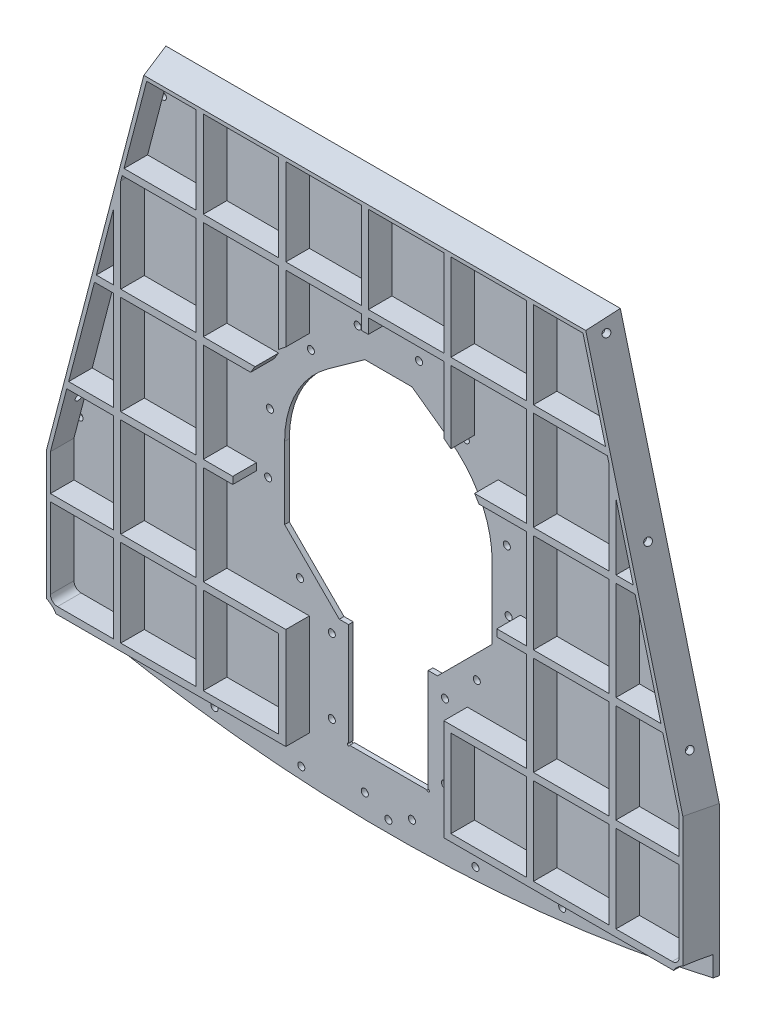
from build123d import *
from OCP.BRepFilletAPI import BRepFilletAPI_MakeChamfer

# Parameters (mm, degrees)
EXTRUDE_1_DEPTH          = 60
CHAMFER_1_SIZE           = 60
CHAMFER_1_SIZE_2         = 20
CUT_EXTRUDE_1_DEPTH      = 267.176633084
CUT_EXTRUDE_1_DEPTH_BACK = 267.176633084
CHAMFER_2_SIZE           = 20
CHAMFER_2_SIZE_2         = 60
SKETCH_16_W              = 396.041589692
SKETCH_16_H              = 439.610751022
CUT_EXTRUDE_14_DEPTH     = 58
SKETCH_17_OUTSIDE_W      = 369.102
SKETCH_17_OUTSIDE_H      = 333.102
CUT_EXTRUDE_15_DEPTH     = 5
SKETCH_19_R              = 1.5
CUT_EXTRUDE_17_DEPTH     = 3
SKETCH_21_R              = 0.5
CUT_EXTRUDE_19_DEPTH     = 10
SKETCH_22_W              = 32
SKETCH_22_H              = 37
SKETCH_22_W_2            = 26.833333333
SKETCH_22_H_2            = 42
SKETCH_22_H_3            = 36.869219076
EXTRUDE_6_DEPTH          = 10
SKETCH_24_R              = 8.5
SKETCH_24_W              = 3
SKETCH_24_H              = 8
CUT_EXTRUDE_20_DEPTH     = 10
CHAMFER_4_SIZE           = 12
CHAMFER_4_SIZE_2         = 3.440944629
FILLET_2_R               = 3
SKETCH_28_R              = 1.5
CUT_EXTRUDE_22_DEPTH     = 5


# Some blends are built 0.0001 mm under size
with BuildPart() as part:
    # 草图1 → 凸台-拉伸1 (new body)
    with BuildSketch(Plane.XY):
        Polygon((145, -15), (145, -95), (-145, -95), (-145, -15), (-85, 215), (85, 215), align=None)
    extrude(amount=-EXTRUDE_1_DEPTH)

    # 倒角1
    chamfer_1_edges_1 = [part.edges().sort_by_distance(p)[0] for p in [
        (115, 100, -60),
    ]]
    chamfer_1_side_1 = [part.faces().sort_by_distance(p)[0] for p in [
        (115, 100, -59.6),
    ]]
    chamfer_1_edges_2 = [part.edges().sort_by_distance(p)[0] for p in [
        (145, -55, -60),
    ]]
    chamfer_1_side_2 = [part.faces().sort_by_distance(p)[0] for p in [
        (145, -55, -59.6),
    ]]
    chamfer_1_edges_3 = [part.edges().sort_by_distance(p)[0] for p in [
        (-115, 100, -60),
    ]]
    chamfer_1_side_3 = [part.faces().sort_by_distance(p)[0] for p in [
        (-115, 100, -59.6),
    ]]
    chamfer_1_edges_4 = [part.edges().sort_by_distance(p)[0] for p in [
        (-145, -55, -60),
    ]]
    chamfer_1_side_4 = [part.faces().sort_by_distance(p)[0] for p in [
        (-145, -55, -59.6),
    ]]
    chamfer_1 = BRepFilletAPI_MakeChamfer(part.part.solid().wrapped)
    for e in chamfer_1_edges_1:
        chamfer_1.Add(CHAMFER_1_SIZE - 0.0001, CHAMFER_1_SIZE_2 - 0.0001, e.wrapped, chamfer_1_side_1[0].wrapped)
    for e in chamfer_1_edges_2:
        chamfer_1.Add(CHAMFER_1_SIZE - 0.0001, CHAMFER_1_SIZE_2 - 0.0001, e.wrapped, chamfer_1_side_2[0].wrapped)
    for e in chamfer_1_edges_3:
        chamfer_1.Add(CHAMFER_1_SIZE - 0.0001, CHAMFER_1_SIZE_2 - 0.0001, e.wrapped, chamfer_1_side_3[0].wrapped)
    for e in chamfer_1_edges_4:
        chamfer_1.Add(CHAMFER_1_SIZE - 0.0001, CHAMFER_1_SIZE_2 - 0.0001, e.wrapped, chamfer_1_side_4[0].wrapped)
    add(Compound.cast(chamfer_1.Shape()), mode=Mode.REPLACE)  # a hair under: the kernel refuses the full size

    # 草图2 → 切除-拉伸1 (cut, two sides: drawn at the far end of the back side and taken through both)
    with BuildSketch(Plane(origin=(0, 0, 0), x_dir=(0, 0, -1), z_dir=(1, 0, 0)).offset(-CUT_EXTRUDE_1_DEPTH_BACK)):
        Polygon((10, 215), (0, 145), (0, 215), align=None)
    extrude(amount=CUT_EXTRUDE_1_DEPTH + CUT_EXTRUDE_1_DEPTH_BACK, mode=Mode.SUBTRACT)

    # 倒角2
    # the kernel refuses this chamfer: 60, 20 mm, written as the material it takes off along each edge
    with BuildSketch(Plane(origin=(-220.034434727, 215, -60), x_dir=(0, -0.9940388851139267, -0.10902612017980699), z_dir=(1, 0, 0))) as chamfer_2_piece_1:
        Polygon((CHAMFER_2_SIZE * 0.994038885114, -CHAMFER_2_SIZE * 0.10902612018), (-CHAMFER_2_SIZE_2 * 0.10902612018, -CHAMFER_2_SIZE_2 * 0.994038885114), (0, 0), align=None)
    extrude(amount=440.068869454, mode=Mode.SUBTRACT)

    # 草图16 → 切除-拉伸14 (cut)
    with BuildSketch(Plane(origin=(0, 0, -60), x_dir=(-1, 0, 0), z_dir=(0, 0, -1))):
        Rectangle(SKETCH_16_W, SKETCH_16_H)
    extrude(amount=-CUT_EXTRUDE_14_DEPTH, mode=Mode.SUBTRACT)

    # 草图17 outside → 切除-拉伸15 (cut)
    with BuildSketch(Plane(origin=(0, 0, -2), x_dir=(-1, 0, 0), z_dir=(0, 0, -1))):
        with Locations((0, 32)):
            Rectangle(SKETCH_17_OUTSIDE_W, SKETCH_17_OUTSIDE_H)
        Polygon((-138.333333333, -89), (-138.333333333, -99), (138.333333333, -99), (138.333333333, -89), (138.333333333, -15.855254053), (96.371093146, 145), (-96.371093146, 145), (-138.333333333, -15.855254053), align=None, mode=Mode.SUBTRACT)
    extrude(amount=-CUT_EXTRUDE_15_DEPTH, mode=Mode.SUBTRACT)

    # 草图19 → 切除-拉伸17 (cut)
    with BuildSketch(Plane.XY):
        with BuildLine():
            ThreePointArc((-2.311e-06, -95), (-69.621618106, -91.013886221), (-138.333333333, -79.107640827))
            Line((-138.333333333, -79.107640827), (-138.333333333, -95))
            Line((-138.333333333, -95), (-2.311e-06, -95))
        make_face()
        with BuildLine():
            ThreePointArc((138.333333333, -79.107640827), (69.62161581, -91.013886485), (-2.311e-06, -95))
            Line((-2.311e-06, -95), (138.333333333, -95))
            Line((138.333333333, -95), (138.333333333, -79.107640827))
        make_face()
        with BuildLine():
            ThreePointArc((-25.681989593, 62.727236257), (-39.153592058, 47.074765975), (-44, 27))
            Line((-44, 27), (-44, -3.578427125))
            Line((-44, -3.578427125), (-20.828427125, -26.75))
            Line((-20.828427125, -26.75), (-16.9, -26.75))
            Line((-16.9, -26.75), (-16.9, -70.85))
            Line((-16.9, -70.85), (16.9, -70.85))
            Line((16.9, -70.85), (16.9, -26.75))
            Line((16.9, -26.75), (20.828427125, -26.75))
            Line((20.828427125, -26.75), (44, -3.578427125))
            Line((44, -3.578427125), (44, 27))
            ThreePointArc((44, 27), (39.153592058, 47.074765975), (25.681989593, 62.727236257))
            Line((25.681989593, 62.727236257), (10, 74))
            Line((10, 74), (-10, 74))
            Line((-10, 74), (-25.681989593, 62.727236257))
        make_face()
        with Locations((0, -90)):
            Circle(SKETCH_19_R)
        with Locations((95.631962399, 128.02522732)):
            Circle(SKETCH_19_R)
        with Locations((113.3014952, 60.292018253)):
            Circle(SKETCH_19_R)
        with Locations((130.971028, -7.441190815)):
            Circle(SKETCH_19_R)
        with Locations((40, 135)):
            Circle(SKETCH_19_R)
        with Locations(Location((-40, 135, 0), (0, 0, 180))):
            Circle(SKETCH_19_R)
        with Locations((-130.971028, -7.441190815)):
            Circle(SKETCH_19_R)
        with Locations(Location((-113.3014952, 60.292018253, 0), (0, 0, 180))):
            Circle(SKETCH_19_R)
        with Locations(Location((-95.631962399, 128.02522732, 0), (0, 0, 180))):
            Circle(SKETCH_19_R)
        with Locations((-36.934366419, -88.871553045)):
            Circle(SKETCH_19_R)
        with Locations((-73.73095276, -85.490421743)):
            Circle(SKETCH_19_R)
        with Locations((-110.252492923, -79.869219076)):
            Circle(SKETCH_19_R)
        with Locations((36.934366419, -88.871553045)):
            Circle(SKETCH_19_R)
        with Locations((73.73095276, -85.490421743)):
            Circle(SKETCH_19_R)
        with Locations((110.252492923, -79.869219076)):
            Circle(SKETCH_19_R)
        with Locations((-13.003070927, 85)):
            Circle(SKETCH_19_R)
        with Locations((-32.844913848, 66.143044077)):
            Circle(SKETCH_19_R)
        with Locations((-50.225195404, 35.856057061)):
            Circle(SKETCH_19_R)
        with Locations((-51, 10.261038969)):
            Circle(SKETCH_19_R)
        with Locations((-37.5, -19.977922061)):
            Circle(SKETCH_19_R)
        with Locations((-24, -33.477922061)):
            Circle(SKETCH_19_R)
        with Locations((-24, -65)):
            Circle(SKETCH_19_R)
        with Locations((-10, -85)):
            Circle(SKETCH_19_R)
        with Locations((10, -85)):
            Circle(SKETCH_19_R)
        with Locations((24, -65)):
            Circle(SKETCH_19_R)
        with Locations((24, -33.477922061)):
            Circle(SKETCH_19_R)
        with Locations((37.5, -19.977922061)):
            Circle(SKETCH_19_R)
        with Locations((51, 10.261038969)):
            Circle(SKETCH_19_R)
        with Locations((50.225195404, 35.856057061)):
            Circle(SKETCH_19_R)
        with Locations((32.844913848, 66.143044077)):
            Circle(SKETCH_19_R)
        with Locations((13.003070927, 85)):
            Circle(SKETCH_19_R)
    extrude(amount=-CUT_EXTRUDE_17_DEPTH, mode=Mode.SUBTRACT)

    # 草图21 → 切除-拉伸19 (cut)
    with BuildSketch(Plane.XY):
        with Locations((-16.9, -70.85)):
            Circle(SKETCH_21_R)
        with Locations((16.9, -70.85)):
            Circle(SKETCH_21_R)
    extrude(amount=-CUT_EXTRUDE_19_DEPTH, mode=Mode.SUBTRACT)

    # 草图22 → 凸台-拉伸6 (add)
    with BuildSketch(Plane.XY):
        with BuildLine():
            Line((138.333333333, -15.855254053), (96.371093146, 145))
            Line((96.371093146, 145), (-96.371093146, 145))
            Line((-96.371093146, 145), (-96.371093146, 140))
            Line((-96.371093146, 140), (-1.5, 140))
            Line((-1.5, 140), (-1.5, 86))
            Line((-1.5, 86), (1.5, 86))
            Line((1.5, 86), (1.5, 100.130780924))
            Line((1.5, 100.130780924), (33.5, 100.130780924))
            Line((33.5, 100.130780924), (33.5, 71.874825905))
            ThreePointArc((33.5, 71.874825905), (35.020638229, 70.698454184), (36.5, 69.470578051))
            Line((36.5, 69.470578051), (36.5, 100.130780924))
            Line((36.5, 100.130780924), (68.5, 100.130780924))
            Line((68.5, 100.130780924), (68.5, 58.130780924))
            Line((68.5, 58.130780924), (46.549699022, 58.130780924))
            ThreePointArc((46.549699022, 58.130780924), (47.509375317, 56.645560494), (48.421680729, 55.130780924))
            Line((48.421680729, 55.130780924), (68.5, 55.130780924))
            Line((68.5, 55.130780924), (68.5, 13.130780924))
            Line((68.5, 13.130780924), (56, 13.130780924))
            Line((56, 13.130780924), (56, 10.130780924))
            Line((56, 10.130780924), (68.5, 10.130780924))
            Line((68.5, 10.130780924), (68.5, -31.869219076))
            Line((68.5, -31.869219076), (33.5, -31.869219076))
            Line((33.5, -31.869219076), (33.5, -74.869219076))
            Line((33.5, -74.869219076), (133.333333333, -74.869219076))
            Line((133.333333333, -74.869219076), (133.333333333, -79.107640827))
            Line((133.333333333, -79.107640827), (138.333333333, -79.107640827))
            Line((138.333333333, -79.107640827), (138.333333333, -15.855254053))
        make_face()
        Polygon((125.604426677, 13.130780924), (106.5, 13.130780924), (106.5, 55.130780924), (114.647904938, 55.130780924), align=None, mode=Mode.SUBTRACT)
        with Locations((52.5, -53.369219076)):
            Rectangle(SKETCH_22_W, SKETCH_22_H, mode=Mode.SUBTRACT)
        with Locations((87.5, -53.369219076)):
            Rectangle(SKETCH_22_W, SKETCH_22_H, mode=Mode.SUBTRACT)
        with Locations((119.916666667, -53.369219076)):
            Rectangle(SKETCH_22_W_2, SKETCH_22_H, mode=Mode.SUBTRACT)
        with Locations((87.5, -10.869219076)):
            Rectangle(SKETCH_22_W, SKETCH_22_H_2, mode=Mode.SUBTRACT)
        Polygon((106.5, 10.130780924), (126.387035372, 10.130780924), (133.333333333, -16.496694593), (133.333333333, -31.869219076), (106.5, -31.869219076), align=None, mode=Mode.SUBTRACT)
        with Locations((17.5, 121.565390462)):
            Rectangle(SKETCH_22_W, SKETCH_22_H_3, mode=Mode.SUBTRACT)
        with Locations((52.5, 121.565390462)):
            Rectangle(SKETCH_22_W, SKETCH_22_H_3, mode=Mode.SUBTRACT)
        with Locations((87.5, 34.130780924)):
            Rectangle(SKETCH_22_W, SKETCH_22_H_2, mode=Mode.SUBTRACT)
        Polygon((103.5, 58.130780924), (71.5, 58.130780924), (71.5, 100.130780924), (102.908774503, 100.130780924), (103.5, 97.864416518), align=None, mode=Mode.SUBTRACT)
        Polygon((106.5, 86.364416518), (113.865296242, 58.130780924), (106.5, 58.130780924), align=None, mode=Mode.SUBTRACT)
        Polygon((71.5, 103.130780924), (71.5, 140), (92.508108657, 140), (102.126165807, 103.130780924), align=None, mode=Mode.SUBTRACT)
    extrude_6 = extrude(amount=EXTRUDE_6_DEPTH)

    # 镜向1: 凸台-拉伸6 across plane
    add(extrude_6.mirror(Plane(origin=(0, 0, 0), x_dir=(0, 0, 1), z_dir=(1, 0, 0))))

    # 草图24 → 切除-拉伸20 (cut)
    with BuildSketch(Plane.XY.offset(10)):
        with Locations((138.333333333, -79.107640827)):
            Circle(SKETCH_24_R)
        with Locations((-138.333333333, -79.107640827)):
            Circle(SKETCH_24_R)
        with Locations((0, 90)):
            Rectangle(SKETCH_24_W, SKETCH_24_H)
    extrude(amount=-CUT_EXTRUDE_20_DEPTH, mode=Mode.SUBTRACT)

    # 倒角4
    # the kernel refuses this chamfer: 12, 3.440944629 mm, written as the material it takes off along each edge
    with BuildSketch(Plane(origin=(-138.333333333, -101.76291072, 10), x_dir=(-0.010616657410322184, 0, -0.9999436417045873), z_dir=(0, 1, 0))) as chamfer_4_piece_1:
        Polygon((CHAMFER_4_SIZE * 0.999943641705, -CHAMFER_4_SIZE * 0.0106166574103), (-CHAMFER_4_SIZE_2 * 0.0106166574106, -CHAMFER_4_SIZE_2 * 0.999943641735), (0, 0), align=None)
    extrude(amount=117.06292656, mode=Mode.SUBTRACT)
    with BuildSketch(Plane(origin=(-146.197605666, -46.001631328, 10), x_dir=(0.9596497656963242, -0.2503434171381715, 0.12806443961761413), z_dir=(0.2524218971470027, 0.9676172723968439, 0))) as chamfer_4_piece_2:
        Polygon((CHAMFER_4_SIZE_2 * 0.991765849062, CHAMFER_4_SIZE_2 * 0.128064439622), (-CHAMFER_4_SIZE * 0.128064439618, CHAMFER_4_SIZE * 0.991765849032), (0, 0), align=None)
    extrude(amount=228.549050241, mode=Mode.SUBTRACT)
    with BuildSketch(Plane(origin=(127.526363039, 145, 10), x_dir=(0, 0.010616657410322184, -0.9999436417045873), z_dir=(-1, 0, 0))) as chamfer_4_piece_3:
        Polygon((CHAMFER_4_SIZE * 0.999943641705, CHAMFER_4_SIZE * 0.0106166574103), (-CHAMFER_4_SIZE_2 * 0.0106166574106, CHAMFER_4_SIZE_2 * 0.999943641735), (0, 0), align=None)
    extrude(amount=255.052726077, mode=Mode.SUBTRACT)
    with BuildSketch(Plane(origin=(146.197605666, -46.001631328, 10), x_dir=(0.010272861085346637, 0.0026798768048730357, -0.9999436417045873), z_dir=(-0.2524218971470027, 0.9676172723968439, 0))) as chamfer_4_piece_4:
        Polygon((CHAMFER_4_SIZE * 0.999943641705, CHAMFER_4_SIZE * 0.0106166574103), (-CHAMFER_4_SIZE_2 * 0.0106166574106, CHAMFER_4_SIZE_2 * 0.999943641735), (0, 0), align=None)
    extrude(amount=228.549050241, mode=Mode.SUBTRACT)
    with BuildSketch(Plane(origin=(138.333333333, -101.76291072, 10), x_dir=(0.010616657410322184, 0, -0.9999436417045873), z_dir=(0, 1, 0))) as chamfer_4_piece_5:
        Polygon((CHAMFER_4_SIZE * 0.999943641705, CHAMFER_4_SIZE * 0.0106166574103), (-CHAMFER_4_SIZE_2 * 0.0106166574106, CHAMFER_4_SIZE_2 * 0.999943641735), (0, 0), align=None)
    extrude(amount=117.06292656, mode=Mode.SUBTRACT)

    # 圆角2
    fillet_2_edges = [part.edges().sort_by_distance(p)[0] for p in [
        (133.333333333, -71.869219076, 5),
        (-133.333333333, -71.869219076, 5),
    ]]
    fillet(fillet_2_edges, radius=FILLET_2_R)

    # 草图28 → 切除-拉伸22 (cut)
    with BuildSketch(Plane(origin=(115.58768703, 30.15330966, 34.25345625), x_dir=(0.2667114664063188, 0.06957690427990924, -0.9612616959383202), z_dir=(0.9301334202834016, 0.24264350094349663, 0.2756373558169948))):
        with Locations(Location((31.668875646, -30.055542597, 0), (0, 0, 355.887202721))):
            Circle(SKETCH_28_R)
        with Locations(Location((31.668875646, 109.944457403, 0), (0, 0, 355.887202721))):
            Circle(SKETCH_28_R)
        with Locations(Location((31.668875646, 39.944457403, 0), (0, 0, 355.887202721))):
            Circle(SKETCH_28_R)
    cut_extrude_22 = extrude(amount=-CUT_EXTRUDE_22_DEPTH, mode=Mode.SUBTRACT)

    # 镜向2: 切除-拉伸22 across plane
    add(cut_extrude_22.mirror(Plane(origin=(0, 0, 0), x_dir=(0, 0, 1), z_dir=(1, 0, 0))), mode=Mode.SUBTRACT)


solid = part.part
